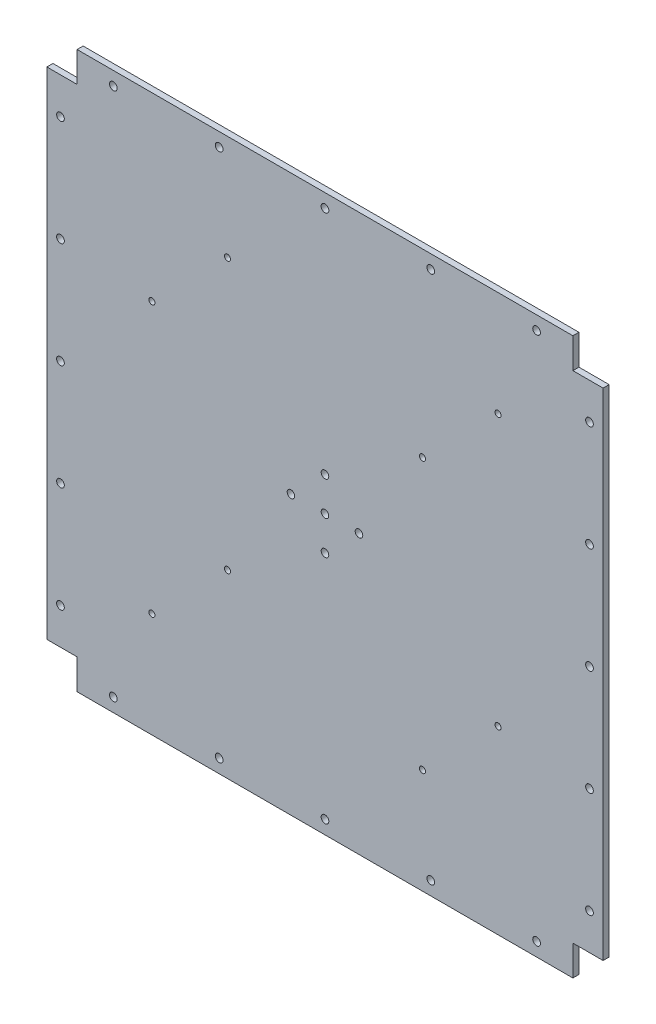
from build123d import *

# Parameters (mm, degrees)
SKETCH_1_W          = 368
SKETCH_1_H          = 368
EXTRUDE_1_DEPTH     = 4
SKETCH_3_R          = 2.55
CUT_EXTRUDE_2_DEPTH = 261.246037434
SKETCH_4_W          = 20
SKETCH_4_H          = 20
CUT_EXTRUDE_3_DEPTH = 261.246037434
SKETCH_5_R          = 2.5
CUT_EXTRUDE_6_DEPTH = 10
SKETCH_6_R          = 2
CUT_EXTRUDE_7_DEPTH = 261.246037434


with BuildPart() as part:
    # 草图1 → 凸台-拉伸1 (new body)
    with BuildSketch(Plane.XY):
        Rectangle(SKETCH_1_W, SKETCH_1_H)
    extrude(amount=EXTRUDE_1_DEPTH)

    # 草图3 → 切除-拉伸2 (cut, through all)
    with BuildSketch(Plane.XY.offset(4)):
        with Locations((0, -175)):
            Circle(SKETCH_3_R)
        with Locations((70, -175)):
            Circle(SKETCH_3_R)
        with Locations((140, -175)):
            Circle(SKETCH_3_R)
        with Locations((-70, -175)):
            Circle(SKETCH_3_R)
        with Locations((-140, -175)):
            Circle(SKETCH_3_R)
        with Locations((-175, 140)):
            Circle(SKETCH_3_R)
        with Locations((-175, 70)):
            Circle(SKETCH_3_R)
        with Locations((-175, -70)):
            Circle(SKETCH_3_R)
        with Locations((-175, -140)):
            Circle(SKETCH_3_R)
        with Locations((-175, 0)):
            Circle(SKETCH_3_R)
        with Locations((140, 175)):
            Circle(SKETCH_3_R)
        with Locations((70, 175)):
            Circle(SKETCH_3_R)
        with Locations((-70, 175)):
            Circle(SKETCH_3_R)
        with Locations((-140, 175)):
            Circle(SKETCH_3_R)
        with Locations((0, 175)):
            Circle(SKETCH_3_R)
        with Locations((175, -140)):
            Circle(SKETCH_3_R)
        with Locations((175, -70)):
            Circle(SKETCH_3_R)
        with Locations((175, 70)):
            Circle(SKETCH_3_R)
        with Locations((175, 140)):
            Circle(SKETCH_3_R)
        with Locations((175, 0)):
            Circle(SKETCH_3_R)
    extrude(amount=-CUT_EXTRUDE_2_DEPTH, mode=Mode.SUBTRACT)

    # 草图4 → 切除-拉伸3 (cut, through all)
    with BuildSketch(Plane.XY.offset(4)):
        with Locations((-174, 174)):
            Rectangle(SKETCH_4_W, SKETCH_4_H)
        with Locations((-174, -174)):
            Rectangle(SKETCH_4_W, SKETCH_4_H)
        with Locations((174, 174)):
            Rectangle(SKETCH_4_W, SKETCH_4_H)
        with Locations((174, -174)):
            Rectangle(SKETCH_4_W, SKETCH_4_H)
    extrude(amount=-CUT_EXTRUDE_3_DEPTH, mode=Mode.SUBTRACT)

    # 草图5 → 切除-拉伸6 (cut)
    with BuildSketch(Plane.XY.offset(4)):
        with Locations((0, 22.5)):
            Circle(SKETCH_5_R)
        with Locations((22.5, 0)):
            Circle(SKETCH_5_R)
        with Locations((-22.5, 0)):
            Circle(SKETCH_5_R)
        with Locations((0, -22.5)):
            Circle(SKETCH_5_R)
        Circle(SKETCH_5_R)
    extrude(amount=-CUT_EXTRUDE_6_DEPTH, mode=Mode.SUBTRACT)

    # 草图6 → 切除-拉伸7 (cut, through all)
    with BuildSketch(Plane(origin=(0, 0, 0), x_dir=(-1, 0, 0), z_dir=(0, 0, -1))):
        with Locations((114.5, 64.5)):
            Circle(SKETCH_6_R)
        with Locations((64.5, 114.5)):
            Circle(SKETCH_6_R)
        with Locations((114.5, -114.5)):
            Circle(SKETCH_6_R)
        with Locations((64.5, -64.5)):
            Circle(SKETCH_6_R)
        with Locations((-64.5, -114.5)):
            Circle(SKETCH_6_R)
        with Locations((-114.5, -64.5)):
            Circle(SKETCH_6_R)
        with Locations((-64.5, 64.5)):
            Circle(SKETCH_6_R)
        with Locations((-114.5, 114.5)):
            Circle(SKETCH_6_R)
    extrude(amount=-CUT_EXTRUDE_7_DEPTH, mode=Mode.SUBTRACT)


solid = part.part
